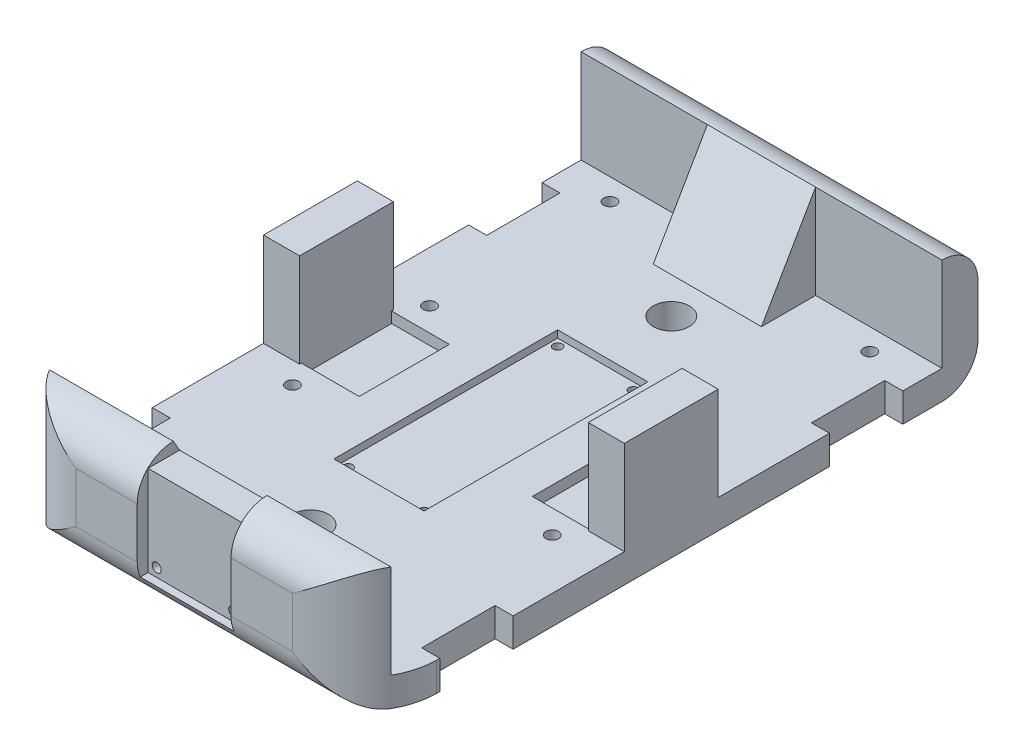
from build123d import *

# Parameters (mm, degrees)
SKETCH_1_W               = 100
SKETCH_1_H               = 150
EXTRUDE_2_DEPTH          = 8
SKETCH_3_R               = 1.75
CUT_EXTRUDE_1_DEPTH      = 91.493093659
MIRROR_2_COPY_1_SKETCH_R = 1.75
MIRROR_2_COPY_1_DEPTH    = 91.493093659
SKETCH_4_W               = 25
SKETCH_4_H               = 62
CUT_EXTRUDE_2_DEPTH      = 2
SKETCH_6_R               = 1.25
CUT_EXTRUDE_3_DEPTH      = 3
SKETCH_7_W               = 10
SKETCH_7_H               = 26
EXTRUDE_3_DEPTH          = 26
SKETCH_8_W               = 30
SKETCH_8_H               = 15
EXTRUDE_4_DEPTH          = 26
SKETCH_9_W               = 16
SKETCH_9_H               = 25
CUT_EXTRUDE_4_DEPTH      = 3
SKETCH_11_W              = 100
SKETCH_11_H              = 34
EXTRUDE_5_DEPTH          = 10
SKETCH_12_W              = 100
SKETCH_12_H              = 34
EXTRUDE_6_DEPTH          = 10
SKETCH_13_W              = 26
SKETCH_13_H              = 28
CUT_EXTRUDE_5_DEPTH      = 3
CUT_EXTRUDE_6_REACH      = 179.609
SKETCH_14_W              = 26
SKETCH_14_H              = 6
CUT_EXTRUDE_7_REACH      = 114.276
CUT_EXTRUDE_8_REACH      = 114.276
SKETCH_19_R              = 1.25
CUT_EXTRUDE_9_DEPTH      = 3
SKETCH_20_W              = 5
SKETCH_20_H              = 20.32
CUT_EXTRUDE_10_DEPTH     = 10
MIRROR_4_COPY_1_SKETCH_W = 5
MIRROR_4_COPY_1_SKETCH_H = 20.32
MIRROR_4_COPY_1_DEPTH    = 10
FILLET_1_R               = 10
FILLET_2_R               = 10
FILLET_3_R               = 20
FILLET_START             = -1
FILLET_4_DEPTH           = 36
FILLET_5_R               = 10
SKETCH_21_R              = 5
CUT_EXTRUDE_11_DEPTH     = 102.985293215


with BuildPart() as part:
    # 草图1 → 凸台-拉伸2 (new body)
    with BuildSketch(Plane(origin=(0, 0, 0), x_dir=(1, 0, 0), z_dir=(0, 1, 0))):
        Rectangle(SKETCH_1_W, SKETCH_1_H)
    extrude(amount=EXTRUDE_2_DEPTH)

    # 草图3 → 切除-拉伸1 (cut, through all)
    with BuildSketch(Plane(origin=(0, 8, 0), x_dir=(1, 0, 0), z_dir=(0, 1, 0))):
        with Locations(Location((-36, -19, 0), (0, 0, 270))):
            Circle(SKETCH_3_R)
        with Locations(Location((-36, -69, 0), (0, 0, 270))):
            Circle(SKETCH_3_R)
    cut_extrude_1 = extrude(amount=-CUT_EXTRUDE_1_DEPTH, mode=Mode.SUBTRACT)

    # 镜向1: 切除-拉伸1 across plane
    add(cut_extrude_1.mirror(Plane(origin=(0, 0, 0), x_dir=(0, 0, 1), z_dir=(1, 0, 0))), mode=Mode.SUBTRACT)

    # 镜向2: 切除-拉伸1 across plane
    add(cut_extrude_1.mirror(Plane.XY), mode=Mode.SUBTRACT)

    # 镜向2 copy 1 sketch → 镜向2 copy 1 (cut, through all)
    with BuildSketch(Plane(origin=(0, 8, 0), x_dir=(-1, 0, 0), z_dir=(0, 1, 0))):
        with Locations(Location((-36, -19, 0), (0, 0, 270))):
            Circle(MIRROR_2_COPY_1_SKETCH_R)
        with Locations(Location((-36, -69, 0), (0, 0, 270))):
            Circle(MIRROR_2_COPY_1_SKETCH_R)
    extrude(amount=-MIRROR_2_COPY_1_DEPTH, mode=Mode.SUBTRACT)

    # 草图4 → 切除-拉伸2 (cut)
    with BuildSketch(Plane(origin=(0, 8, 0), x_dir=(1, 0, 0), z_dir=(0, 1, 0))):
        Rectangle(SKETCH_4_W, SKETCH_4_H)
    extrude(amount=-CUT_EXTRUDE_2_DEPTH, mode=Mode.SUBTRACT)

    # 草图6 → 切除-拉伸3 (cut)
    with BuildSketch(Plane(origin=(0, 6, 0), x_dir=(1, 0, 0), z_dir=(0, 1, 0))):
        with Locations(Location((-10.5, 29, 0), (0, 0, 270))):
            Circle(SKETCH_6_R)
        with Locations(Location((10.5, 29, 0), (0, 0, 90))):
            Circle(SKETCH_6_R)
        with Locations(Location((10.5, -29, 0), (0, 0, 270))):
            Circle(SKETCH_6_R)
        with Locations(Location((-10.5, -29, 0), (0, 0, 90))):
            Circle(SKETCH_6_R)
    extrude(amount=-CUT_EXTRUDE_3_DEPTH, mode=Mode.SUBTRACT)

    # 草图7 → 凸台-拉伸3 (add)
    with BuildSketch(Plane(origin=(0, 8, 0), x_dir=(1, 0, 0), z_dir=(0, 1, 0))):
        with Locations((-45, 0)):
            Rectangle(SKETCH_7_W, SKETCH_7_H)
        with Locations((45, 0)):
            Rectangle(SKETCH_7_W, SKETCH_7_H)
    extrude(amount=EXTRUDE_3_DEPTH)

    # 草图8 → 凸台-拉伸4 (add)
    with BuildSketch(Plane(origin=(0, 8, 0), x_dir=(1, 0, 0), z_dir=(0, 1, 0))):
        with Locations((0, 67.5)):
            Rectangle(SKETCH_8_W, SKETCH_8_H)
        with Locations((0, -67.5)):
            Rectangle(SKETCH_8_W, SKETCH_8_H)
    extrude(amount=EXTRUDE_4_DEPTH)

    # 草图9 → 切除-拉伸4 (cut)
    with BuildSketch(Plane(origin=(0, 8, 0), x_dir=(1, 0, 0), z_dir=(0, 1, 0))):
        with Locations((-32, 0)):
            Rectangle(SKETCH_9_W, SKETCH_9_H)
        with Locations((32, 0)):
            Rectangle(SKETCH_9_W, SKETCH_9_H)
    extrude(amount=-CUT_EXTRUDE_4_DEPTH, mode=Mode.SUBTRACT)

    # 草图11 → 凸台-拉伸5 (add)
    with BuildSketch(Plane(origin=(0, 0, -75), x_dir=(-1, 0, 0), z_dir=(0, 0, -1))):
        with Locations((0, 17)):
            Rectangle(SKETCH_11_W, SKETCH_11_H)
    extrude(amount=EXTRUDE_5_DEPTH)

    # 草图12 → 凸台-拉伸6 (add)
    with BuildSketch(Plane.XY.offset(75)):
        with Locations((0, 17)):
            Rectangle(SKETCH_12_W, SKETCH_12_H)
    extrude(amount=EXTRUDE_6_DEPTH)

    # 草图13 → 切除-拉伸5 (cut)
    with BuildSketch(Plane.XY.offset(85)):
        with Locations((0, 20)):
            Rectangle(SKETCH_13_W, SKETCH_13_H)
    extrude(amount=-CUT_EXTRUDE_5_DEPTH, mode=Mode.SUBTRACT)

    # 草图14 → 切除-拉伸6 (cut, up to next)
    with BuildSketch(Plane.XY.offset(82), mode=Mode.PRIVATE) as cut_extrude_6_sk1:
        with Locations((0, 34)):
            Rectangle(SKETCH_14_W, SKETCH_14_H)
    cut_extrude_6_tool1 = extrude(cut_extrude_6_sk1.sketch, amount=-CUT_EXTRUDE_6_REACH, mode=Mode.PRIVATE) & part.part
    add(cut_extrude_6_tool1.solids().sort_by_distance((0, 34, 82))[0], mode=Mode.SUBTRACT)

    # 草图17 → 切除-拉伸7 (cut, up to next)
    with BuildSketch(Plane.ZY.offset(15), mode=Mode.PRIVATE) as cut_extrude_7_sk1:
        Polygon((75, 34), (60, 8), (60, 34), align=None)
    cut_extrude_7_tool1 = extrude(cut_extrude_7_sk1.sketch, amount=-CUT_EXTRUDE_7_REACH, mode=Mode.PRIVATE) & part.part
    add(cut_extrude_7_tool1.solids().sort_by_distance((-15, 25.333333, 65))[0], mode=Mode.SUBTRACT)

    # 草图18 → 切除-拉伸8 (cut, up to next)
    with BuildSketch(Plane.ZY.offset(15), mode=Mode.PRIVATE) as cut_extrude_8_sk1:
        Polygon((-75, 34), (-60, 8), (-60, 34), align=None)
    cut_extrude_8_tool1 = extrude(cut_extrude_8_sk1.sketch, amount=-CUT_EXTRUDE_8_REACH, mode=Mode.PRIVATE) & part.part
    add(cut_extrude_8_tool1.solids().sort_by_distance((-15, 25.333333, -65))[0], mode=Mode.SUBTRACT)

    # 草图19 → 切除-拉伸9 (cut)
    with BuildSketch(Plane.XY.offset(82)):
        with Locations((-10.6, 8.4)):
            Circle(SKETCH_19_R)
        with Locations(Location((10.6, 8.4, 0), (0, 0, 180))):
            Circle(SKETCH_19_R)
    extrude(amount=-CUT_EXTRUDE_9_DEPTH, mode=Mode.SUBTRACT)

    # 草图20 → 切除-拉伸10 (cut)
    with BuildSketch(Plane(origin=(0, 8, 0), x_dir=(1, 0, 0), z_dir=(0, 1, 0))):
        with Locations((-47.5, -54)):
            Rectangle(SKETCH_20_W, SKETCH_20_H)
    cut_extrude_10 = extrude(amount=-CUT_EXTRUDE_10_DEPTH, mode=Mode.SUBTRACT)

    # 镜向3: 切除-拉伸10 across plane
    add(cut_extrude_10.mirror(Plane.XY), mode=Mode.SUBTRACT)

    # 镜向4: 切除-拉伸10 across plane
    add(cut_extrude_10.mirror(Plane(origin=(0, 0, 0), x_dir=(0, 0, 1), z_dir=(1, 0, 0))), mode=Mode.SUBTRACT)

    # 镜向4 copy 1 sketch → 镜向4 copy 1 (cut)
    with BuildSketch(Plane(origin=(0, 8, 0), x_dir=(-1, 0, 0), z_dir=(0, 1, 0))):
        with Locations((-47.5, -54)):
            Rectangle(MIRROR_4_COPY_1_SKETCH_W, MIRROR_4_COPY_1_SKETCH_H)
    extrude(amount=-MIRROR_4_COPY_1_DEPTH, mode=Mode.SUBTRACT)

    # 圆角1
    # the kernel refuses this fillet: 10 mm, written as the material it takes off along each edge
    with BuildSketch(Plane(origin=(75, 0, 85), x_dir=(0, 0, -1), z_dir=(-1, 0, 0))) as fillet_1_piece_1:
        with BuildLine():
            CenterArc((FILLET_1_R, -FILLET_1_R), FILLET_1_R, 90, 90)
            Line((0, -FILLET_1_R), (0, 0))
            Line((0, 0), (FILLET_1_R, 0))
        make_face()
    extrude(amount=150, mode=Mode.SUBTRACT)

    # 圆角2
    fillet_2_edges = [part.edges().sort_by_distance(p)[0] for p in [
        (31.5, 34, 85),
        (-31.5, 34, 85),
    ]]
    fillet(fillet_2_edges, radius=FILLET_2_R - 0.0001)  # a hair under: the kernel refuses the full size

    # 圆角3
    # the kernel refuses this fillet: 20 mm, written as the material it takes off along each edge
    with BuildSketch(Plane(origin=(50, 74.0001, 85), x_dir=(0, 0, -1), z_dir=(0, -1, 0))) as fillet_3_piece_1:
        with BuildLine():
            CenterArc((FILLET_3_R, -FILLET_3_R), FILLET_3_R, 90, 90)
            Line((0, -FILLET_3_R), (0, 0))
            Line((0, 0), (FILLET_3_R, 0))
        make_face()
    extrude(amount=114.0001, mode=Mode.SUBTRACT)

    # 圆角4: read off the stored shape, not the designer's step
    # 圆角4 outline → 圆角4 (cut)
    with BuildSketch(Plane(origin=(0, 0, 0), x_dir=(1, 0, 0), z_dir=(0, 1, 0)).offset(FILLET_START)):
        with BuildLine():
            ThreePointArc((-30, -85), (-44.142135624, -79.142135624), (-50, -65))
            Line((-50, -65), (-50, -85))
            Line((-50, -85), (-30, -85))
        make_face()
    extrude(amount=FILLET_4_DEPTH, mode=Mode.SUBTRACT)

    # 圆角5
    fillet_5_edges = [part.edges().sort_by_distance(p)[0] for p in [
        (0, 0, -85),
        (0, 34, -85),
    ]]
    fillet(fillet_5_edges, radius=FILLET_5_R - 0.0001)  # a hair under: the kernel refuses the full size

    # 草图21 → 切除-拉伸11 (cut, through all)
    with BuildSketch(Plane(origin=(0, 8, 0), x_dir=(1, 0, 0), z_dir=(0, 1, 0))):
        with Locations(Location((0, 50, 0), (0, 0, 270))):
            Circle(SKETCH_21_R)
        with Locations(Location((0, -50, 0), (0, 0, 90))):
            Circle(SKETCH_21_R)
    extrude(amount=-CUT_EXTRUDE_11_DEPTH, mode=Mode.SUBTRACT)


solid = part.part
